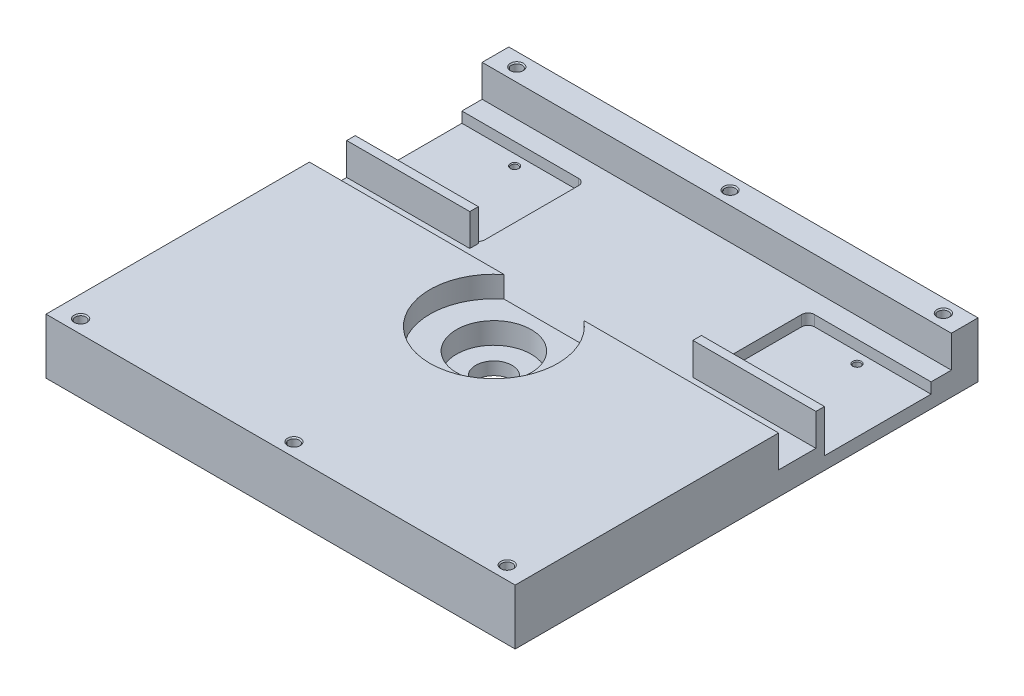
from build123d import *

# Parameters (mm, degrees)
SKETCH1_W                       = 220
SKETCH1_H                       = 217
BLOCO_BRUTO_DEPTH               = 26
SKETCH2_R                       = 8.5
FURO_17_PASSANTE_DEPTH          = 157.678811586
SKETCH2_3_R                     = 17.5
SKETCH2_3_R_2                   = 8.5
REBAIXO_35X20_DEPTH             = 20
SKETCH2_4_R                     = 30
SKETCH2_4_R_2                   = 17.5
REBAIXO_60X10_DEPTH             = 10
REBAIXO_220X81X15_DEPTH         = 15
REBAIXO_ENCAIXE_MANCAIS_DEPTH   = 5
M6X1_0_FUROS_APOIO_D            = 5
M6X1_0_FUROS_APOIO_DEPTH        = 17
M6X1_0_FUROS_APOIO_CSINK_D      = 6.05
M6X1_0_FUROS_APOIO_CSINK_ANGLE  = 90
M6X1_0_FUROS_APOIO_TIP          = 1.502151548
M4X0_7_TAPPED_HOLE1_D           = 3.3
M4X0_7_TAPPED_HOLE1_DEPTH       = 11.5
M4X0_7_TAPPED_HOLE1_CSINK_D     = 4.05
M4X0_7_TAPPED_HOLE1_CSINK_ANGLE = 90
M4X0_7_TAPPED_HOLE1_TIP         = 0.991420021


with BuildPart() as part:
    # Sketch1 → Bloco (Bruto) (new body)
    with BuildSketch(Plane(origin=(0, 0, 0), x_dir=(1, 0, 0), z_dir=(0, 1, 0))):
        Rectangle(SKETCH1_W, SKETCH1_H)
    extrude(amount=BLOCO_BRUTO_DEPTH)

    # Sketch2 → Furo Ø17 Passante (cut, through all)
    with BuildSketch(Plane(origin=(0, 26, 0), x_dir=(1, 0, 0), z_dir=(0, 1, 0))):
        with Locations((0, -8.5)):
            Circle(SKETCH2_R)
    extrude(amount=-FURO_17_PASSANTE_DEPTH, mode=Mode.SUBTRACT)

    # Sketch2<3> → Rebaixo Ø35x20 (cut)
    with BuildSketch(Plane(origin=(0, 26, 0), x_dir=(1, 0, 0), z_dir=(0, 1, 0))):
        with Locations((0, -8.5)):
            Circle(SKETCH2_3_R)
        with Locations((0, -8.5)):
            Circle(SKETCH2_3_R_2, mode=Mode.SUBTRACT)
    extrude(amount=-REBAIXO_35X20_DEPTH, mode=Mode.SUBTRACT)

    # Sketch2<4> → Rebaixo Ø60x10 (cut)
    with BuildSketch(Plane(origin=(0, 26, 0), x_dir=(1, 0, 0), z_dir=(0, 1, 0))):
        with Locations((0, -8.5)):
            Circle(SKETCH2_4_R)
        with Locations((0, -8.5)):
            Circle(SKETCH2_4_R_2, mode=Mode.SUBTRACT)
    extrude(amount=-REBAIXO_60X10_DEPTH, mode=Mode.SUBTRACT)

    # Sketch3 → Rebaixo 220x81x15 (cut)
    with BuildSketch(Plane(origin=(0, 26, 0), x_dir=(1, 0, 0), z_dir=(0, 1, 0))):
        Polygon((110, 36.5), (110, 96), (-110, 96), (-110, 36.5), (-52.3, 36.5), (-52.3, 32.5), (-110, 32.5), (-110, 15), (110, 15), (110, 32.5), (52.3, 32.5), (52.3, 36.5), align=None)
    extrude(amount=-REBAIXO_220X81X15_DEPTH, mode=Mode.SUBTRACT)

    # Sketch4 → Rebaixo - Encaixe Mancais (cut)
    with BuildSketch(Plane(origin=(0, 11, 0), x_dir=(1, 0, 0), z_dir=(0, 1, 0))):
        with BuildLine():
            Line((-110, 86.5), (-55.3, 86.5))
            ThreePointArc((-55.3, 86.5), (-53.178679656, 85.621320344), (-52.3, 83.5))
            Line((-52.3, 83.5), (-52.3, 39.5))
            ThreePointArc((-52.3, 39.5), (-53.178679656, 37.378679656), (-55.3, 36.5))
            Line((-55.3, 36.5), (-110, 36.5))
            Line((-110, 36.5), (-110, 86.5))
        make_face()
        with BuildLine():
            Line((110, 36.5), (55.3, 36.5))
            ThreePointArc((55.3, 36.5), (53.178679656, 37.378679656), (52.3, 39.5))
            Line((52.3, 39.5), (52.3, 83.5))
            ThreePointArc((52.3, 83.5), (53.178679656, 85.621320344), (55.3, 86.5))
            Line((55.3, 86.5), (110, 86.5))
            Line((110, 86.5), (110, 36.5))
        make_face()
    extrude(amount=-REBAIXO_ENCAIXE_MANCAIS_DEPTH, mode=Mode.SUBTRACT)

    # M6x1.0 - Furos Apoio
    with Locations(Plane(origin=(0, 26, 0), x_dir=(1, 0, 0), z_dir=(0, 1, 0))):
        with Locations((-100, -102.25), (0, -102.25), (100, -102.25), (-100, 102.25), (0, 102.25), (100, 102.25)):
            CounterSinkHole(M6X1_0_FUROS_APOIO_D / 2, M6X1_0_FUROS_APOIO_CSINK_D / 2, depth=M6X1_0_FUROS_APOIO_DEPTH, counter_sink_angle=M6X1_0_FUROS_APOIO_CSINK_ANGLE)
            with Locations((0, 0, -(M6X1_0_FUROS_APOIO_DEPTH + M6X1_0_FUROS_APOIO_TIP / 2))):  # 118° drill point
                Cone(0, M6X1_0_FUROS_APOIO_D / 2, M6X1_0_FUROS_APOIO_TIP, mode=Mode.SUBTRACT)

    # M4x0.7 Tapped Hole1
    with Locations(Plane(origin=(0, 6, 0), x_dir=(1, 0, 0), z_dir=(0, 1, 0))):
        with Locations((-80.3, 81.5), (-80.3, 41.5), (80.3, 81.5), (80.3, 41.5)):
            CounterSinkHole(M4X0_7_TAPPED_HOLE1_D / 2, M4X0_7_TAPPED_HOLE1_CSINK_D / 2, depth=M4X0_7_TAPPED_HOLE1_DEPTH, counter_sink_angle=M4X0_7_TAPPED_HOLE1_CSINK_ANGLE)
            with Locations((0, 0, -(M4X0_7_TAPPED_HOLE1_DEPTH + M4X0_7_TAPPED_HOLE1_TIP / 2))):  # 118° drill point
                Cone(0, M4X0_7_TAPPED_HOLE1_D / 2, M4X0_7_TAPPED_HOLE1_TIP, mode=Mode.SUBTRACT)


solid = part.part
